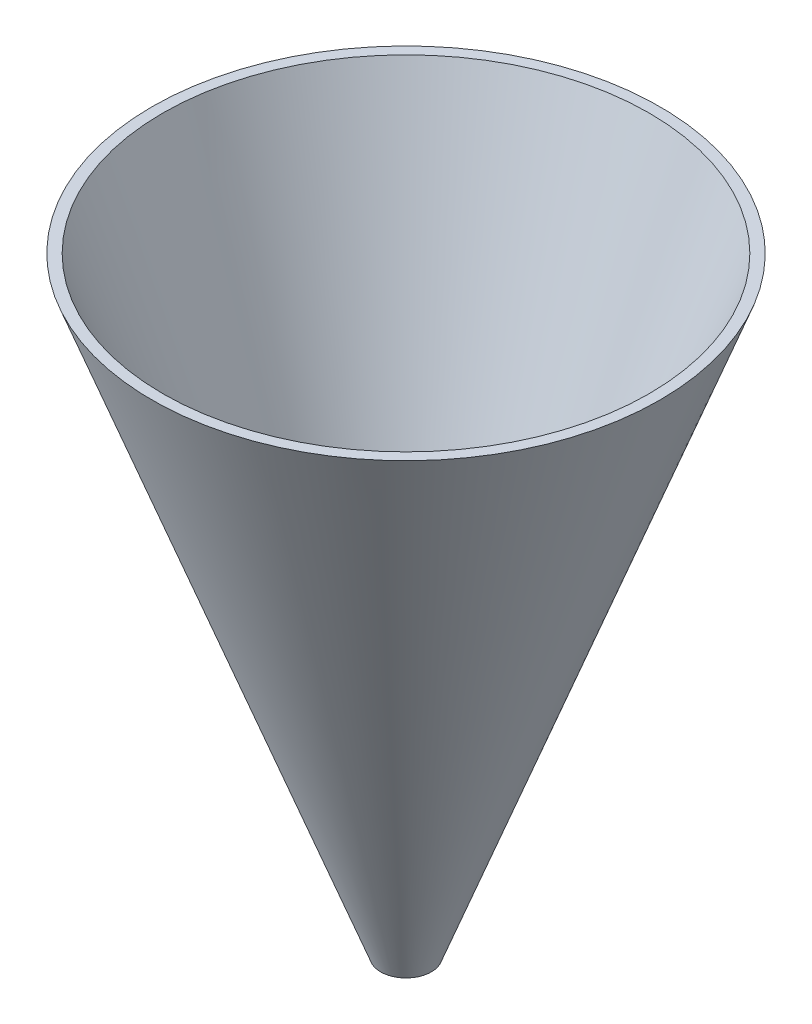
from build123d import *

# Parameters (mm, degrees)
SHELL1_T           = -2.54
SKETCH3_R          = 1.27
CUT_EXTRUDE1_DEPTH = 2.54


with BuildPart() as part:
    # Sketch2 → Revolve2 (revolve)
    with BuildSketch(Plane.XY):
        Polygon((0, 0), (6.35, 0), (63.5, 152.4), (0, 152.4), align=None)
    revolve(axis=Axis((0, 152.4, 0), (0, -1, 0)))

    # Shell1
    shell1_openings = [part.faces().sort_by_distance(p)[0] for p in [
        (0, 152.4, 0),
    ]]
    offset(amount=SHELL1_T, openings=shell1_openings, kind=Kind.INTERSECTION)

    # Sketch3 → Cut-Extrude1 (cut)
    with BuildSketch(Plane.XZ):
        with Locations((-1.778, 0)):
            Circle(SKETCH3_R)
        with Locations((1.778, 0)):
            Circle(SKETCH3_R)
    extrude(amount=-CUT_EXTRUDE1_DEPTH, mode=Mode.SUBTRACT)


solid = part.part
